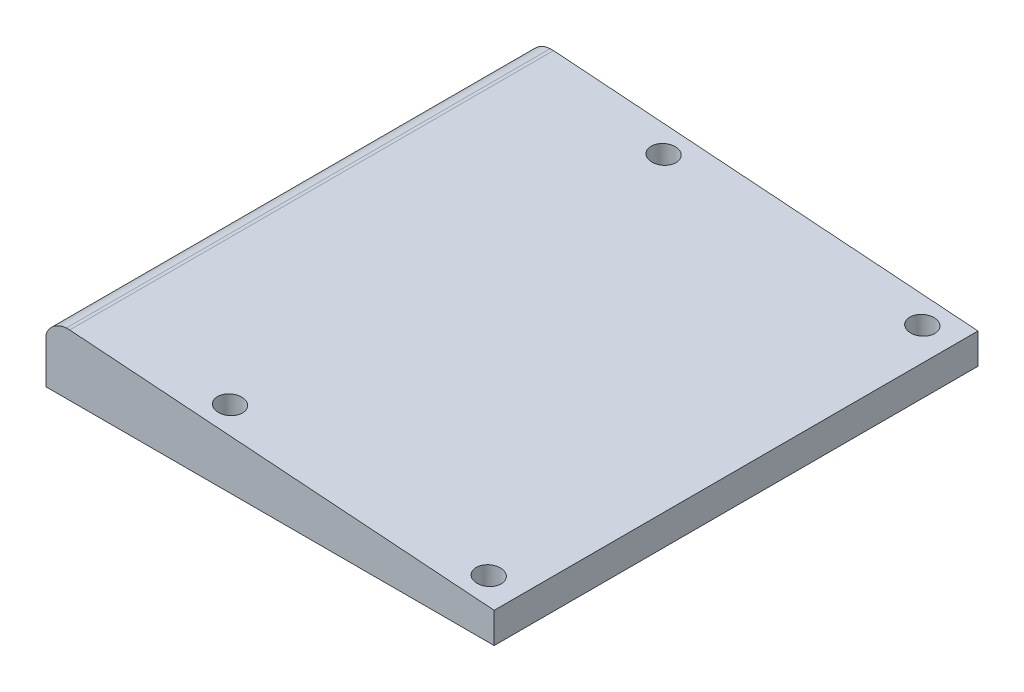
from build123d import *

# Parameters (mm, degrees)
SKETCH1_W                               = 220
SKETCH1_H                               = 237.5
BOSS_EXTRUDE1_DEPTH                     = 30
CUT_EXTRUDE1_DEPTH                      = 165.625522019
CUT_EXTRUDE1_DEPTH_BACK                 = 165.625522019
CBORE_FOR_M5_HEX_HEAD_BOLT1_D           = 5.5
CBORE_FOR_M5_HEX_HEAD_BOLT1_CBORE_D     = 12.24
CBORE_FOR_M5_HEX_HEAD_BOLT1_CBORE_DEPTH = 23.58


with BuildPart() as part:
    # Sketch1 → Boss-Extrude1 (new body)
    with BuildSketch(Plane(origin=(0, 0, 0), x_dir=(1, 0, 0), z_dir=(0, 1, 0))):
        Rectangle(SKETCH1_W, SKETCH1_H)
    extrude(amount=BOSS_EXTRUDE1_DEPTH)

    # Sketch2 → Cut-Extrude1 (cut, two sides: drawn at the far end of the back side and taken through both)
    with BuildSketch(Plane.XY.offset(-CUT_EXTRUDE1_DEPTH_BACK)):
        with BuildLine():
            ThreePointArc((-110, 15), (-108.693194947, 24.94629799), (-100.027360933, 30))
            Line((-100.027360933, 30), (-110, 30))
            ThreePointArc((-110, 30), (-111.231375541, 22.5), (-110, 15))
        make_face()
        Polygon((-98.392171464, 30), (110, 15), (110, 30), align=None)
    extrude(amount=CUT_EXTRUDE1_DEPTH + CUT_EXTRUDE1_DEPTH_BACK, mode=Mode.SUBTRACT)

    # CBORE for M5 Hex Head Bolt1 (through all)
    with Locations(Plane(origin=(0, 30.029387085, 0), x_dir=(1, 0, 0), z_dir=(0, 1, 0))):
        with Locations((-32, 106.42), (95, 106.42), (95, -106.42), (-32, -106.42)):
            CounterBoreHole(CBORE_FOR_M5_HEX_HEAD_BOLT1_D / 2, CBORE_FOR_M5_HEX_HEAD_BOLT1_CBORE_D / 2, CBORE_FOR_M5_HEX_HEAD_BOLT1_CBORE_DEPTH)


solid = part.part
